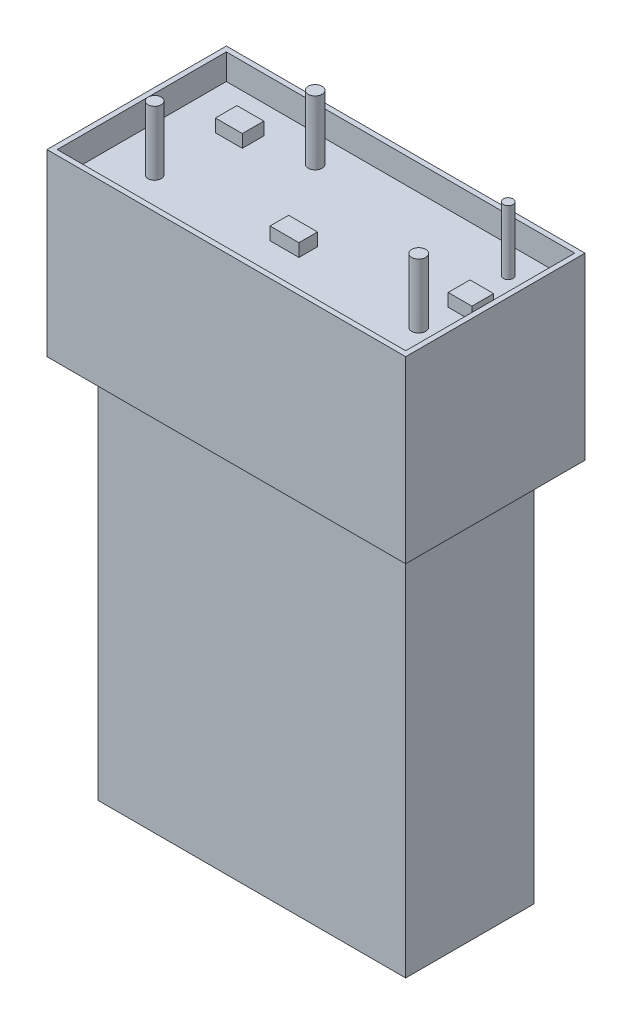
from build123d import *

# Parameters (mm, degrees)
SKETCH1_W           = 12000
SKETCH1_H           = 5000
BOSS_EXTRUDE1_DEPTH = 15000
SKETCH2_W           = 14000
SKETCH2_H           = 7000
BOSS_EXTRUDE2_DEPTH = 6000
SKETCH3_W           = 14000
SKETCH3_H           = 7000
SKETCH3_W_2         = 13600
SKETCH3_H_2         = 6600
BOSS_EXTRUDE3_DEPTH = 1000
SKETCH4_W           = 1049.969098562
SKETCH4_H           = 840.219930543
SKETCH4_W_2         = 1127.878396032
SKETCH4_H_2         = 725.200774448
SKETCH4_W_3         = 924.827627364
SKETCH4_H_3         = 848.717356224
BOSS_EXTRUDE4_DEPTH = 500
SKETCH5_R           = 271.931197036
SKETCH5_R_2         = 273.548394489
SKETCH5_R_3         = 258.072287822
SKETCH5_R_4         = 190.94954072
BOSS_EXTRUDE5_DEPTH = 2500


with BuildPart() as part:
    # Sketch1 → Boss-Extrude1 (new body)
    with BuildSketch(Plane(origin=(0, 0, 0), x_dir=(1, 0, 0), z_dir=(0, 1, 0))):
        Rectangle(SKETCH1_W, SKETCH1_H)
    extrude(amount=BOSS_EXTRUDE1_DEPTH)

    # Sketch2 → Boss-Extrude2 (add)
    with BuildSketch(Plane(origin=(0, 15000, 0), x_dir=(1, 0, 0), z_dir=(0, 1, 0))):
        Rectangle(SKETCH2_W, SKETCH2_H)
    extrude(amount=BOSS_EXTRUDE2_DEPTH)

    # Sketch3 → Boss-Extrude3 (add)
    with BuildSketch(Plane(origin=(0, 21000, 0), x_dir=(1, 0, 0), z_dir=(0, 1, 0))):
        Rectangle(SKETCH3_W, SKETCH3_H)
        Rectangle(SKETCH3_W_2, SKETCH3_H_2, mode=Mode.SUBTRACT)
    extrude(amount=BOSS_EXTRUDE3_DEPTH)

    # Sketch4 → Boss-Extrude4 (add)
    with BuildSketch(Plane(origin=(0, 21000, 0), x_dir=(1, 0, 0), z_dir=(0, 1, 0))):
        with Locations((-4754.176628247, 1773.552806211)):
            Rectangle(SKETCH4_W, SKETCH4_H)
        with Locations((0, -867.663547302)):
            Rectangle(SKETCH4_W_2, SKETCH4_H_2)
        with Locations((5621.523846524, 424.358678112)):
            Rectangle(SKETCH4_W_3, SKETCH4_H_3)
    extrude(amount=BOSS_EXTRUDE4_DEPTH)

    # Sketch5 → Boss-Extrude5 (add)
    with BuildSketch(Plane(origin=(0, 21000, 0), x_dir=(1, 0, 0), z_dir=(0, 1, 0))):
        with Locations((-2270.095584956, 2238.373193315)):
            Circle(SKETCH5_R)
        with Locations((5262.848698071, -1254.612412688)):
            Circle(SKETCH5_R_2)
        with Locations((-5042.358088057, -1254.612412688)):
            Circle(SKETCH5_R_3)
        with Locations((5262.848698071, 2238.373193315)):
            Circle(SKETCH5_R_4)
    extrude(amount=BOSS_EXTRUDE5_DEPTH)


solid = part.part
